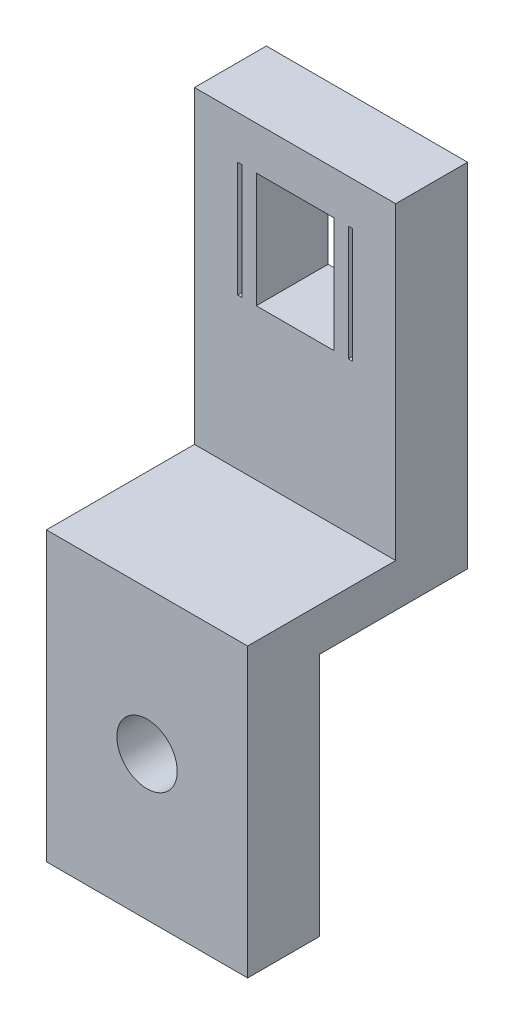
from build123d import *

# Parameters (mm, degrees)
SKETCH1_W           = 14
SKETCH1_H           = 41.5
SKETCH1_W_2         = 5.4
SKETCH1_H_2         = 8
SKETCH1_W_3         = 0.3
SKETCH1_R           = 2.1
BOSS_EXTRUDE3_DEPTH = 15.3
SKETCH2_W           = 10.3
SKETCH2_H           = 17
SKETCH2_H_2         = 21.5
CUT_EXTRUDE1_DEPTH  = 21


with BuildPart() as part:
    # Sketch1 → Boss-Extrude3 (new body)
    with BuildSketch(Plane.XY):
        with Locations((7, 20.75)):
            Rectangle(SKETCH1_W, SKETCH1_H)
        with Locations((7, 34.5)):
            Rectangle(SKETCH1_W_2, SKETCH1_H_2, mode=Mode.SUBTRACT)
        with Locations((3.15, 34.5)):
            Rectangle(SKETCH1_W_3, SKETCH1_H_2, mode=Mode.SUBTRACT)
        with Locations((7, 10)):
            Circle(SKETCH1_R, mode=Mode.SUBTRACT)
        with Locations((10.85, 34.5)):
            Rectangle(SKETCH1_W_3, SKETCH1_H_2, mode=Mode.SUBTRACT)
    extrude(amount=BOSS_EXTRUDE3_DEPTH)

    # Sketch2 → Cut-Extrude1 (cut)
    with BuildSketch(Plane.ZY):
        with Locations((5.15, 8.5)):
            Rectangle(SKETCH2_W, SKETCH2_H)
        with Locations((10.15, 30.75)):
            Rectangle(SKETCH2_W, SKETCH2_H_2)
    extrude(amount=-CUT_EXTRUDE1_DEPTH, mode=Mode.SUBTRACT)


solid = part.part
